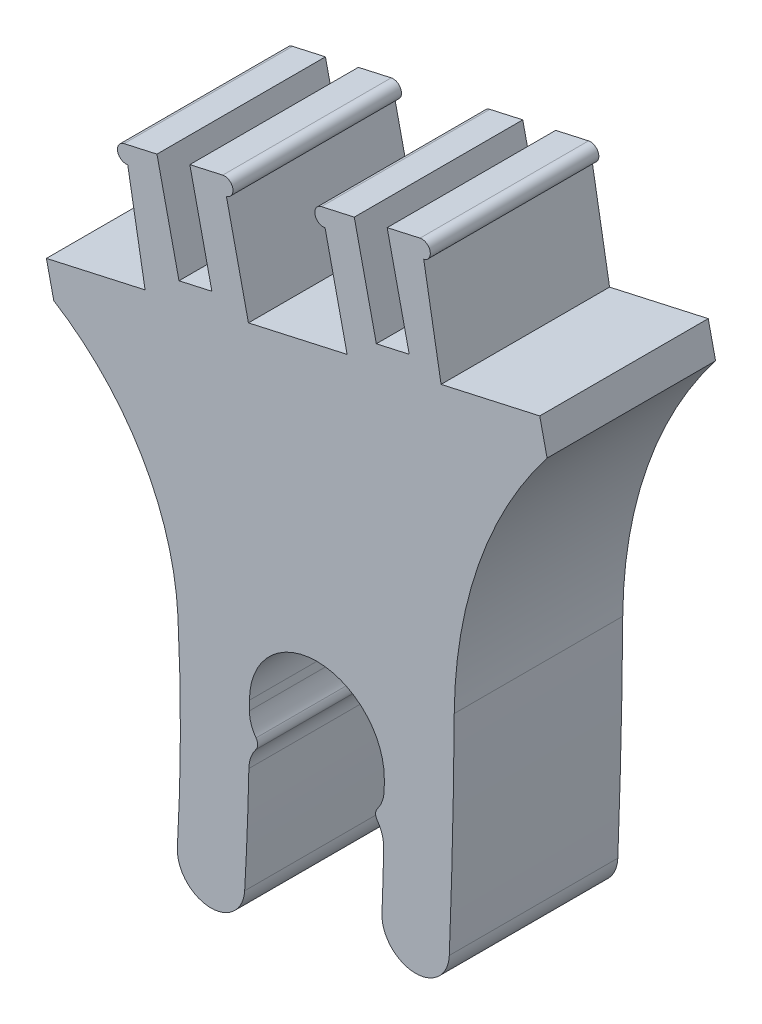
from build123d import *

# Parameters (mm, degrees)
BOSS_EXTRUDE1_DEPTH = 5
FILLET1_R           = 1
FILLET2_R           = 1
BOSS_EXTRUDE2_DEPTH = 5
BOSS_EXTRUDE3_DEPTH = 5
CUT_EXTRUDE1_DEPTH  = 5
BOSS_EXTRUDE4_DEPTH = 5


with BuildPart() as part:
    # Sketch1 → Boss-Extrude1 (new body)
    with BuildSketch(Plane.XY):
        with BuildLine():
            Line((46.328585563, 67.665133516), (48.353724123, 68.117689166))
            ThreePointArc((48.353724123, 68.117689166), (48.398647133, 75.753686317), (47.81637492, 83.367583456))
            Line((47.81637492, 83.367583456), (39.963901457, 81.612799216))
            ThreePointArc((39.963901457, 81.612799216), (40.443341541, 73.963706944), (40.231134371, 66.302542314))
            Line((40.231134371, 66.302542314), (42.267565607, 66.757621526))
            ThreePointArc((42.267565607, 66.757621526), (42.38586051, 68.984034012), (42.447007404, 71.212748282))
            ThreePointArc((42.447007404, 71.212748282), (42.700281141, 71.459795226), (42.452870187, 71.712713391))
            ThreePointArc((42.452870187, 71.712713391), (42.455422518, 72.097266143), (42.4562733, 72.481826424))
            ThreePointArc((42.4562733, 72.481826424), (44.4562733, 74.481826424), (46.4562733, 72.481826424))
            ThreePointArc((46.4562733, 72.481826424), (46.455410169, 72.085672321), (46.452820794, 71.68952574))
            ThreePointArc((46.452820794, 71.68952574), (46.200314758, 71.442404649), (46.447088433, 71.189559074))
            ThreePointArc((46.447088433, 71.189559074), (46.404927274, 69.426771663), (46.328585563, 67.665133516))
        make_face()
    extrude(amount=BOSS_EXTRUDE1_DEPTH)

    # Fillet1
    fillet1_edges = [part.edges().sort_by_distance(p)[0] for p in [
        (46.447088433, 71.189559074, 2.5),
        (46.452820794, 71.68952574, 2.5),
        (42.452870187, 71.712713391, 2.5),
        (42.447007404, 71.212748282, 2.5),
    ]]
    fillet(fillet1_edges, radius=FILLET1_R)

    # Fillet2
    fillet2_edges = [part.edges().sort_by_distance(p)[0] for p in [
        (48.353724123, 68.117689166, 2.5),
        (46.328585563, 67.665133516, 2.5),
        (42.267565607, 66.757621526, 2.5),
        (40.231134371, 66.302542314, 2.5),
    ]]
    fillet(fillet2_edges, radius=FILLET2_R - 0.0001)  # a hair under: the kernel refuses the full size

    # Sketch2 → Boss-Extrude2 (add)
    with BuildSketch(Plane.XY.offset(5)):
        with BuildLine():
            Line((39.70200957, 79.50494448), (38.844189625, 84.436573388))
            Line((38.844189625, 84.436573388), (41.771975747, 85.090842768))
            Line((41.771975747, 85.090842768), (42.426245127, 82.163056646))
            Line((42.426245127, 82.163056646), (40.317359796, 67.626756722))
            ThreePointArc((40.317359796, 67.626756722), (40.333588714, 73.582630469), (39.70200957, 79.50494448))
        make_face()
        with BuildLine():
            Line((48.485367937, 81.467752621), (47.627547992, 86.399381529))
            Line((47.627547992, 86.399381529), (44.699761869, 85.745112148))
            Line((44.699761869, 85.745112148), (45.35403125, 82.817326026))
            Line((45.35403125, 82.817326026), (48.38673347, 68.887746621))
            ThreePointArc((48.38673347, 68.887746621), (48.533086838, 75.176988802), (48.485367937, 81.467752621))
        make_face()
    extrude(amount=-BOSS_EXTRUDE2_DEPTH)

    # Sketch3 → Boss-Extrude3 (add)
    with BuildSketch(Plane.XY.offset(5)):
        with BuildLine():
            ThreePointArc((41.66293085, 85.578807122), (41.961435476, 85.389347393), (41.771975747, 85.090842768))
            Line((41.771975747, 85.090842768), (38.844189625, 84.436573388))
            ThreePointArc((38.844189625, 84.436573388), (38.545685, 84.626033116), (38.735144728, 84.924537741))
            Line((38.735144728, 84.924537741), (41.66293085, 85.578807122))
        make_face()
        with BuildLine():
            ThreePointArc((47.518503095, 86.887345882), (47.81700772, 86.697886154), (47.627547992, 86.399381529))
            Line((47.627547992, 86.399381529), (44.699761869, 85.745112148))
            ThreePointArc((44.699761869, 85.745112148), (44.401257244, 85.934571877), (44.590716973, 86.233076502))
            Line((44.590716973, 86.233076502), (47.518503095, 86.887345882))
        make_face()
    extrude(amount=-BOSS_EXTRUDE3_DEPTH)

    # Sketch4 → Cut-Extrude1 (cut)
    with BuildSketch(Plane.XY.offset(5)):
        Polygon((39.711073435, 85.142627535), (40.365342816, 82.214841413), (41.341271523, 82.432931206), (40.687002143, 85.360717328), align=None)
        Polygon((46.542574388, 86.669256089), (45.56664568, 86.451166295), (46.22091506, 83.523380173), (47.196843768, 83.741469966), align=None)
    extrude(amount=-CUT_EXTRUDE1_DEPTH, mode=Mode.SUBTRACT)

    # Sketch5 → Boss-Extrude4 (add)
    with BuildSketch(Plane.XY.offset(5)):
        with BuildLine():
            Line((39.358881592, 81.477596043), (36.43109547, 80.823326663))
            Line((36.43109547, 80.823326663), (36.649185263, 79.847397955))
            ThreePointArc((36.649185263, 79.847397955), (39.257727558, 77.165710562), (40.333588714, 73.582630469))
            Line((40.333588714, 73.582630469), (44.031942568, 76.908555657))
            Line((44.031942568, 76.908555657), (48.533086838, 75.176988802))
            ThreePointArc((48.533086838, 75.176988802), (49.257403766, 79.374463858), (51.288115875, 83.118744857))
            Line((51.288115875, 83.118744857), (51.070026081, 84.094673564))
            Line((51.070026081, 84.094673564), (48.142239959, 83.440404184))
            Line((48.142239959, 83.440404184), (46.362753702, 81.840114326))
            Line((46.362753702, 81.840114326), (39.358881592, 81.477596043))
        make_face()
    extrude(amount=-BOSS_EXTRUDE4_DEPTH)


solid = part.part
